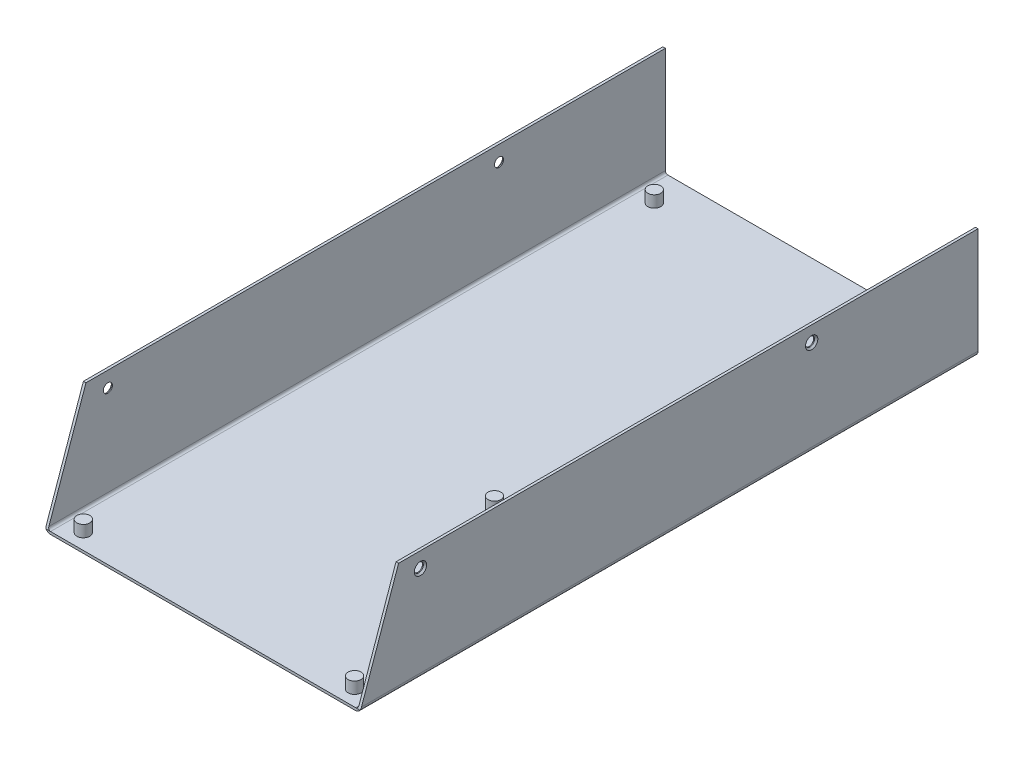
from build123d import *

# Parameters (mm, degrees)
CUT_EXTRUDE2_OUTLINE_R   = 2.5019
CUT_EXTRUDE2_DEPTH       = 5.4864
CUT_EXTRUDE2_START       = -238.9886
CUT_EXTRUDE2_2_DEPTH     = 238.9886
CUT_EXTRUDE2_START_2     = -1
CUT_EXTRUDE2_3_DEPTH     = 124
CUT_EXTRUDE2_START_3     = 120.015
CUT_EXTRUDE2_4_OUTLINE_R = 1.7526
CUT_EXTRUDE2_4_DEPTH     = 2.985
CHAMFER1_SIZE            = 0.635
CHAMFER2_SIZE            = 0.635
CUT_EXTRUDE3_START       = -0.9906
SKETCH2_R                = 1.7526
CUT_EXTRUDE3_DEPTH       = 0.9906
CHAMFER3_SIZE            = 0.635


with BuildPart() as part:
    # Cut-Extrude2: read off the stored shape, not the designer's step
    # Cut-Extrude2 outline → Cut-Extrude2 (new body)
    with BuildSketch(Plane(origin=(0, 0, 0), x_dir=(1, 0, 0), z_dir=(0, 1, 0))):
        with Locations((113.6904, 201.6252)):
            Circle(CUT_EXTRUDE2_OUTLINE_R)
        with Locations((80.4418, 93.3704)):
            Circle(CUT_EXTRUDE2_OUTLINE_R)
        with Locations((113.6904, 5.9944)):
            Circle(CUT_EXTRUDE2_OUTLINE_R)
        with Locations((8.6868, 5.9944)):
            Circle(CUT_EXTRUDE2_OUTLINE_R)
        with Locations((8.6868, 226.9998)):
            Circle(CUT_EXTRUDE2_OUTLINE_R)
    extrude(amount=CUT_EXTRUDE2_DEPTH)

    # Cut-Extrude2 2 outline → Cut-Extrude2 2 (add)
    with BuildSketch(Plane.XY.offset(CUT_EXTRUDE2_START)):
        with BuildLine():
            Line((121.9962, 1.9812), (121.9962, 43.0022))
            Line((121.9962, 43.0022), (121.0056, 43.0022))
            Line((121.0056, 43.0022), (121.0056, 1.9812))
            ThreePointArc((121.0056, 1.9812), (120.715459977, 1.280740023), (120.015, 0.9906))
            Line((120.015, 0.9906), (1.9812, 0.9906))
            ThreePointArc((1.9812, 0.9906), (1.280740019, 1.280740026), (0.9906, 1.98120001))
            Line((0.9906, 1.98120001), (0.9906, 43.0022))
            Line((0.9906, 43.0022), (0, 43.0022))
            Line((0, 43.0022), (0, 1.98120001))
            ThreePointArc((0, 1.98120001), (0.580280042, 0.580280049), (1.9812, 0))
            Line((1.9812, 0), (120.014999999, 0))
            ThreePointArc((120.014999999, 0), (121.415919955, 0.580280045), (121.9962, 1.9812))
        make_face()
    extrude(amount=CUT_EXTRUDE2_2_DEPTH)

    # Cut-Extrude2 3 outline → Cut-Extrude2 3 (cut)
    with BuildSketch(Plane.YZ.offset(CUT_EXTRUDE2_START_2)):
        Polygon((43.0022, 0), (0.9906, 0), (43.002200003, -14.706600001), align=None)
    extrude(amount=CUT_EXTRUDE2_3_DEPTH, mode=Mode.SUBTRACT)

    # Cut-Extrude2 4 outline → Cut-Extrude2 4 (cut)
    with BuildSketch(Plane.YZ.offset(CUT_EXTRUDE2_START_3)):
        with Locations((37.0078, -23.1902)):
            Circle(CUT_EXTRUDE2_4_OUTLINE_R)
        with Locations((37.0078, -174.5996)):
            Circle(CUT_EXTRUDE2_4_OUTLINE_R)
    extrude(amount=CUT_EXTRUDE2_4_DEPTH, mode=Mode.SUBTRACT)

    # Chamfer1
    chamfer1_edges = [part.edges().sort_by_distance(p)[0] for p in [
        (121.9962, 35.2552, -23.1902),
    ]]
    chamfer(chamfer1_edges, length=CHAMFER1_SIZE)

    # Chamfer2
    chamfer2_edges = [part.edges().sort_by_distance(p)[0] for p in [
        (121.9962, 35.2552, -174.5996),
    ]]
    chamfer(chamfer2_edges, length=CHAMFER2_SIZE)

    # Sketch2 → Cut-Extrude3 (cut)
    with BuildSketch(Plane(origin=(0.9906, 0, 0), x_dir=(0, 0, -1), z_dir=(1, 0, 0)).offset(CUT_EXTRUDE3_START)):
        with Locations(Location((23.1902, 37.0078, 0), (0, 0, 180))):
            Circle(SKETCH2_R)
        with Locations(Location((174.5996, 37.0078, 0), (0, 0, 180))):
            Circle(SKETCH2_R)
    extrude(amount=CUT_EXTRUDE3_DEPTH, mode=Mode.SUBTRACT)

    # Chamfer3
    chamfer3_edges = [part.edges().sort_by_distance(p)[0] for p in [
        (0, 37.0078, -24.9428),
        (0, 37.0078, -176.3522),
    ]]
    chamfer(chamfer3_edges, length=CHAMFER3_SIZE)


solid = part.part
